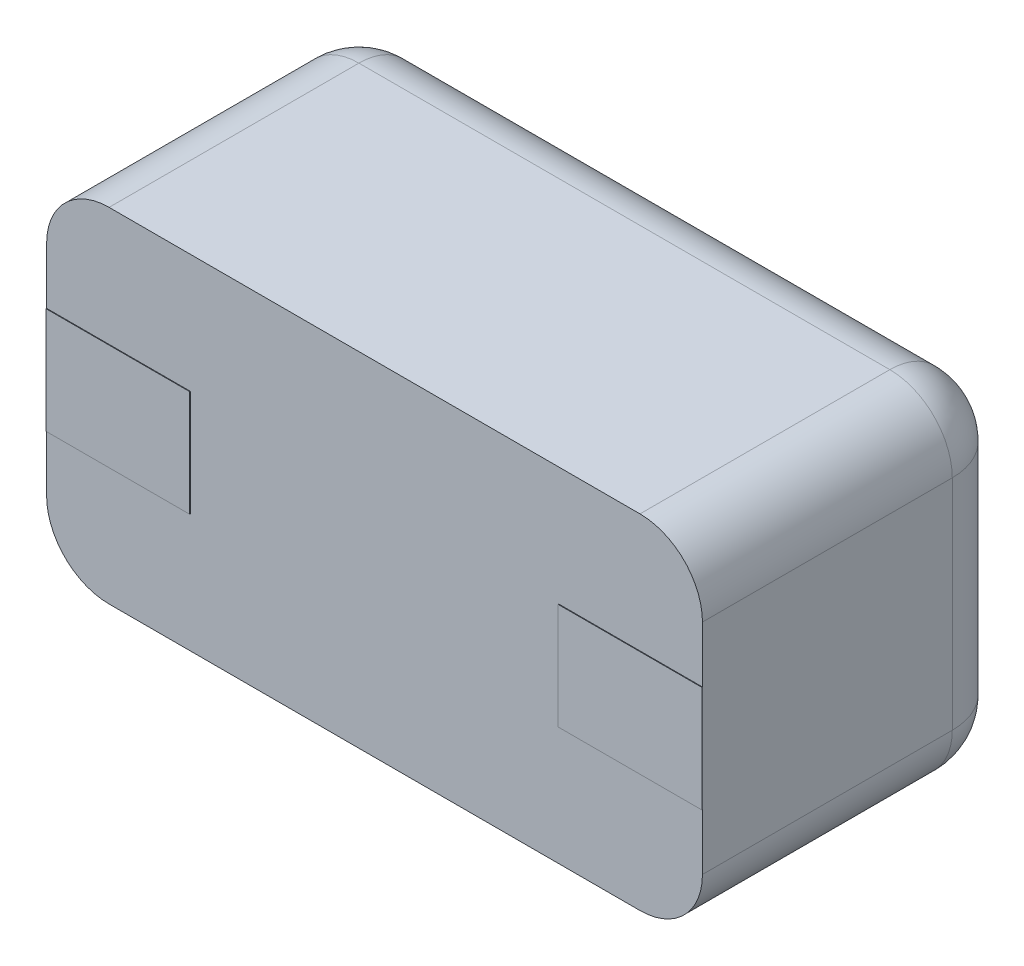
from build123d import *

# Parameters (mm, degrees)
SKETCH1_W           = 10.5
SKETCH1_H           = 5.5
BOSS_EXTRUDE1_DEPTH = 5
SKETCH2_W           = 2.3
SKETCH2_H           = 0.85
BOSS_EXTRUDE2_DEPTH = 0.01
FILLET1_R           = 1
FILLET2_R           = 1


with BuildPart() as part:
    # Sketch1 → Boss-Extrude1 (new body)
    with BuildSketch(Plane.XY):
        with Locations((5.25, 2.75)):
            Rectangle(SKETCH1_W, SKETCH1_H)
    extrude(amount=BOSS_EXTRUDE1_DEPTH)

    # Fillet1
    fillet1_edges = [part.edges().sort_by_distance(p)[0] for p in [
        (5.25, 5.5, 0),
        (10.5, 2.75, 0),
        (5.25, 0, 0),
        (0, 2.75, 0),
    ]]
    fillet(fillet1_edges, radius=FILLET1_R)

    # Fillet2
    # the kernel refuses this fillet: 1 mm, written as the material it takes off along each edge
    with BuildSketch(Plane(origin=(9.5, 4.5, 1), x_dir=(0, 1, 0), z_dir=(1, 0, 0))) as fillet2_piece_1_section:
        Polygon((0, 0), (FILLET2_R, 0), (FILLET2_R, -FILLET2_R), (0, -FILLET2_R), align=None)
    fillet2_piece_1 = extrude(amount=FILLET2_R, mode=Mode.PRIVATE)
    fillet2_piece_1 = fillet2_piece_1 - Plane(origin=(9.5, 4.5, 1), x_dir=(0, -0.7071067811865475, 0.7071067811865475), z_dir=(1, 0, 0)) * Sphere(FILLET2_R, mode=Mode.PRIVATE)
    add(fillet2_piece_1, mode=Mode.SUBTRACT)
    with BuildSketch(Plane(origin=(9.5, 1, 1), x_dir=(1, 0, 0), z_dir=(0, -1, 0))) as fillet2_piece_2_section:
        Polygon((0, 0), (FILLET2_R, 0), (FILLET2_R, -FILLET2_R), (0, -FILLET2_R), align=None)
    fillet2_piece_2 = extrude(amount=FILLET2_R, mode=Mode.PRIVATE)
    fillet2_piece_2 = fillet2_piece_2 - Plane(origin=(9.5, 1, 1), x_dir=(-0.7071067811865475, 0, 0.7071067811865475), z_dir=(0, -1, 0)) * Sphere(FILLET2_R, mode=Mode.PRIVATE)
    add(fillet2_piece_2, mode=Mode.SUBTRACT)
    with BuildSketch(Plane(origin=(1, 4.5, 1), x_dir=(0, 1, 0), z_dir=(-1, 0, 0))) as fillet2_piece_3_section:
        Polygon((0, 0), (FILLET2_R, 0), (FILLET2_R, FILLET2_R), (0, FILLET2_R), align=None)
    fillet2_piece_3 = extrude(amount=FILLET2_R, mode=Mode.PRIVATE)
    fillet2_piece_3 = fillet2_piece_3 - Plane(origin=(1, 4.5, 1), x_dir=(0, -0.7071067811865475, 0.7071067811865475), z_dir=(-1, 0, 0)) * Sphere(FILLET2_R, mode=Mode.PRIVATE)
    add(fillet2_piece_3, mode=Mode.SUBTRACT)
    with BuildSketch(Plane(origin=(1, 1, 1), x_dir=(-1, 0, 0), z_dir=(0, -1, 0))) as fillet2_piece_4_section:
        Polygon((0, 0), (FILLET2_R, 0), (FILLET2_R, FILLET2_R), (0, FILLET2_R), align=None)
    fillet2_piece_4 = extrude(amount=FILLET2_R, mode=Mode.PRIVATE)
    fillet2_piece_4 = fillet2_piece_4 - Plane(origin=(1, 1, 1), x_dir=(0.7071067811865475, 0, 0.7071067811865475), z_dir=(0, -1, 0)) * Sphere(FILLET2_R, mode=Mode.PRIVATE)
    add(fillet2_piece_4, mode=Mode.SUBTRACT)
    with BuildSketch(Plane(origin=(0, 5.5, 1), x_dir=(0, -1, 0), z_dir=(0, 0, 1)), Plane(origin=(0, 0, 1), x_dir=(1, 0, 0), z_dir=(0, 0, 1))) as fillet2_piece_5:
        with BuildLine():
            CenterArc((FILLET2_R, FILLET2_R), FILLET2_R, 180, 90)
            Line((0, FILLET2_R), (0, 0))
            Line((0, 0), (FILLET2_R, 0))
        make_face()
    extrude(amount=6.5, mode=Mode.SUBTRACT)
    with BuildSketch(Plane(origin=(10.5, 5.5, 1), x_dir=(0, -1, 0), z_dir=(0, 0, 1)), Plane(origin=(10.5, 0, 1), x_dir=(-1, 0, 0), z_dir=(0, 0, 1))) as fillet2_piece_6:
        with BuildLine():
            CenterArc((FILLET2_R, -FILLET2_R), FILLET2_R, 90, 90)
            Line((0, -FILLET2_R), (0, 0))
            Line((0, 0), (FILLET2_R, 0))
        make_face()
    extrude(amount=6.5, mode=Mode.SUBTRACT)


with BuildPart() as body_2:
    # Sketch2 → Boss-Extrude2 (new body)
    with BuildSketch(Plane.XY.offset(5)):
        with Locations((1.15, 3.175)):
            Rectangle(SKETCH2_W, SKETCH2_H)
        with Locations((1.15, 2.325)):
            Rectangle(SKETCH2_W, SKETCH2_H)
        with Locations((9.35, 3.175)):
            Rectangle(SKETCH2_W, SKETCH2_H)
        with Locations((9.35, 2.325)):
            Rectangle(SKETCH2_W, SKETCH2_H)
    extrude(amount=BOSS_EXTRUDE2_DEPTH)


solid = Compound([part.part, body_2.part])
